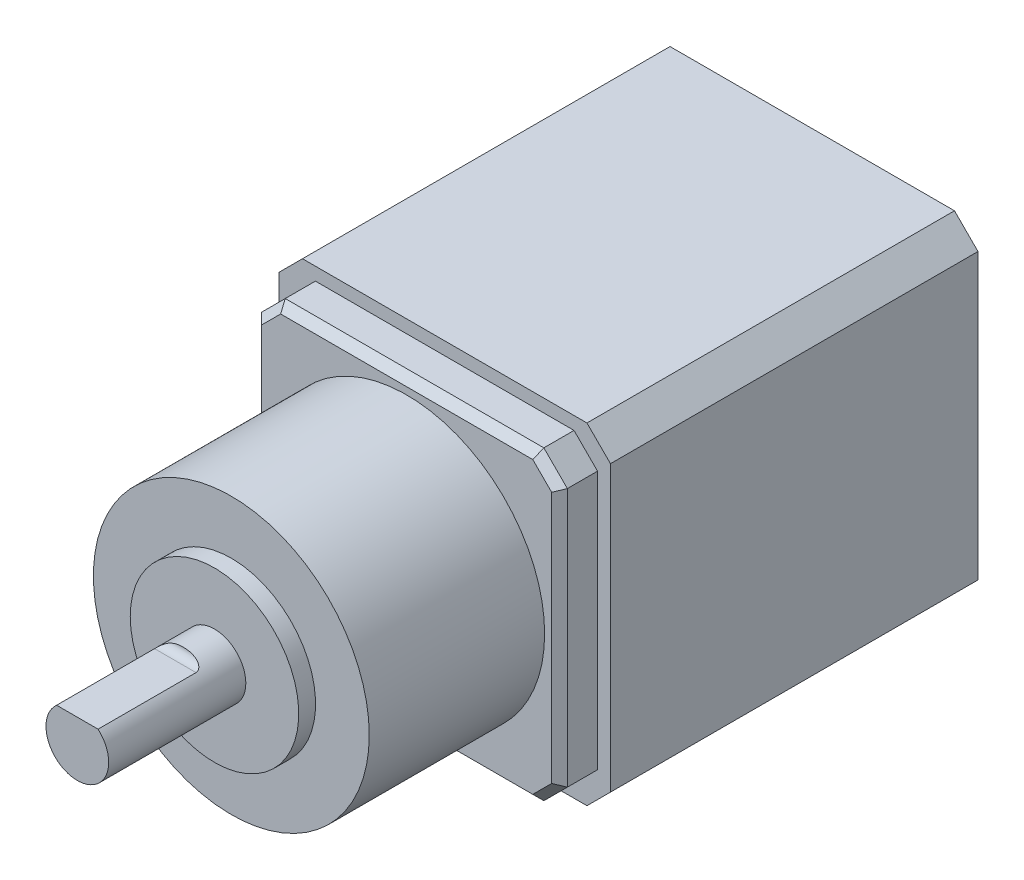
from build123d import *

# Parameters (mm, degrees)
SKETCH1_W           = 42.3
SKETCH1_H           = 42.3
BOSS_EXTRUDE1_DEPTH = 46.9
SKETCH2_W           = 39
SKETCH2_H           = 39
BOSS_EXTRUDE2_DEPTH = 4.85
SKETCH3_R           = 17.6
BOSS_EXTRUDE3_DEPTH = 15.88
SKETCH4_R           = 17.6
BOSS_EXTRUDE4_DEPTH = 6.5
SKETCH5_R           = 10.75
BOSS_EXTRUDE5_DEPTH = 2.15
SKETCH6_R           = 4
BOSS_EXTRUDE6_DEPTH = 17.5
CUT_EXTRUDE1_DEPTH  = 13.5
CHAMFER1_SIZE       = 3
CHAMFER2_SIZE       = 1
FILLET1_R           = 1


with BuildPart() as part:
    # Sketch1 → Boss-Extrude1 (new body)
    with BuildSketch(Plane.XY):
        Rectangle(SKETCH1_W, SKETCH1_H)
    extrude(amount=BOSS_EXTRUDE1_DEPTH)

    # Sketch2 → Boss-Extrude2 (add)
    with BuildSketch(Plane.XY.offset(46.9)):
        Rectangle(SKETCH2_W, SKETCH2_H)
    extrude(amount=BOSS_EXTRUDE2_DEPTH)

    # Sketch3 → Boss-Extrude3 (add)
    with BuildSketch(Plane.XY.offset(51.75)):
        Circle(SKETCH3_R)
    extrude(amount=BOSS_EXTRUDE3_DEPTH)

    # Sketch4 → Boss-Extrude4 (add)
    with BuildSketch(Plane.XY.offset(67.63)):
        Circle(SKETCH4_R)
    extrude(amount=BOSS_EXTRUDE4_DEPTH)

    # Sketch5 → Boss-Extrude5 (add)
    with BuildSketch(Plane.XY.offset(74.13)):
        with Locations(Location((0, 0, 0), (0, 0, 180))):
            Circle(SKETCH5_R)
    extrude(amount=BOSS_EXTRUDE5_DEPTH)

    # Sketch6 → Boss-Extrude6 (add)
    with BuildSketch(Plane.XY.offset(76.28)):
        Circle(SKETCH6_R)
    extrude(amount=BOSS_EXTRUDE6_DEPTH)

    # Sketch7 → Cut-Extrude1 (cut)
    with BuildSketch(Plane.XY.offset(93.78)):
        Polygon((-80.453133814, 3), (-2.645751311, 3), (2.645751311, 3), (80.453133814, 3), (80.453133814, 158.614765005), (-80.453133814, 158.614765005), align=None)
    extrude(amount=-CUT_EXTRUDE1_DEPTH, mode=Mode.SUBTRACT)

    # Chamfer1
    chamfer1_edges = [part.edges().sort_by_distance(p)[0] for p in [
        (19.5, -19.5, 49.325),
        (19.5, 19.5, 49.325),
        (-19.5, 19.5, 49.325),
        (-19.5, -19.5, 49.325),
        (-21.15, -21.15, 23.45),
        (21.15, -21.15, 23.45),
        (21.15, 21.15, 23.45),
        (-21.15, 21.15, 23.45),
    ]]
    chamfer(chamfer1_edges, length=CHAMFER1_SIZE)

    # Chamfer2
    chamfer2_edges = [part.edges().sort_by_distance(p)[0] for p in [
        (-19.5, 0, 51.75),
        (0, 19.5, 51.75),
        (19.5, 0, 51.75),
        (0, -19.5, 51.75),
        (18, 18, 51.75),
        (18, -18, 51.75),
        (-18, -18, 51.75),
        (-18, 18, 51.75),
    ]]
    chamfer(chamfer2_edges, length=CHAMFER2_SIZE)

    # Fillet1
    fillet1_edges = [part.edges().sort_by_distance(p)[0] for p in [
        (0, 3, 80.28),
    ]]
    fillet(fillet1_edges, radius=FILLET1_R - 0.0001)  # a hair under: the kernel refuses the full size


solid = part.part
